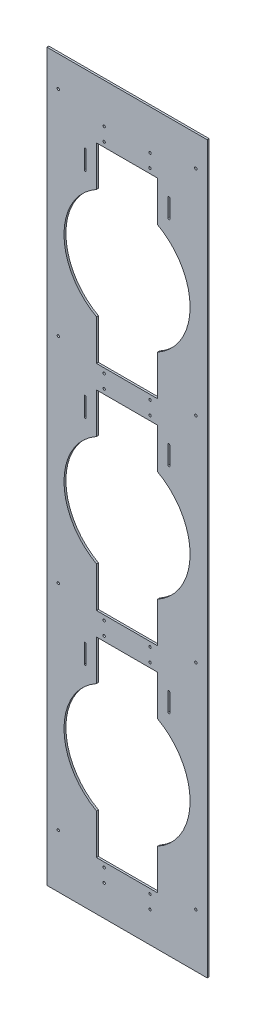
from build123d import *

# Parameters (mm, degrees)
SKETCH1_W                       = 533.4
SKETCH1_H                       = 2413
BOSS_EXTRUDE1_DEPTH             = 6.35
F_5_16_0_3125_DIAMETER_HOLE1_D  = 7.9375
F_1_4_0_25_DIAMETER_SLOT1_DEPTH = 6.35


# Read off the part's stored shape, not the designer's step: 1/4 (0.25) Diameter Slot1
with BuildPart() as part:
    # Sketch1 → Boss-Extrude1 (new body)
    with BuildSketch(Plane.XY):
        with Locations((0, 1206.5)):
            Rectangle(SKETCH1_W, SKETCH1_H)
        with BuildLine():
            Line((-101.6, 797.56), (101.6, 797.56))
            Line((101.6, 797.56), (101.6, 663.332045059))
            ThreePointArc((101.6, 663.332045059), (209.55, 480.06), (101.6, 296.787954941))
            Line((101.6, 296.787954941), (101.6, 162.56))
            Line((101.6, 162.56), (-101.6, 162.56))
            Line((-101.6, 162.56), (-101.6, 296.787954941))
            ThreePointArc((-101.6, 296.787954941), (-209.55, 480.06), (-101.6, 663.332045059))
            Line((-101.6, 663.332045059), (-101.6, 797.56))
        make_face(mode=Mode.SUBTRACT)
        with BuildLine():
            Line((-101.6, 1508.76), (-101.6, 1374.532045059))
            ThreePointArc((-101.6, 1374.532045059), (-209.55, 1191.26), (-101.6, 1007.987954941))
            Line((-101.6, 1007.987954941), (-101.6, 873.76))
            Line((-101.6, 873.76), (101.6, 873.76))
            Line((101.6, 873.76), (101.6, 1007.987954941))
            ThreePointArc((101.6, 1007.987954941), (209.55, 1191.26), (101.6, 1374.532045059))
            Line((101.6, 1374.532045059), (101.6, 1508.76))
            Line((101.6, 1508.76), (-101.6, 1508.76))
        make_face(mode=Mode.SUBTRACT)
        with BuildLine():
            Line((-101.6, 2219.96), (-101.6, 2085.732045059))
            ThreePointArc((-101.6, 2085.732045059), (-209.55, 1902.46), (-101.6, 1719.187954941))
            Line((-101.6, 1719.187954941), (-101.6, 1584.96))
            Line((-101.6, 1584.96), (101.6, 1584.96))
            Line((101.6, 1584.96), (101.6, 1719.187954941))
            ThreePointArc((101.6, 1719.187954941), (209.55, 1902.46), (101.6, 2085.732045059))
            Line((101.6, 2085.732045059), (101.6, 2219.96))
            Line((101.6, 2219.96), (-101.6, 2219.96))
        make_face(mode=Mode.SUBTRACT)
    extrude(amount=BOSS_EXTRUDE1_DEPTH)

    # 5/16 (0.3125) Diameter Hole1 (through all)
    with Locations(Plane.XY.offset(6.35)):
        with Locations((-76.2, 146.685), (-76.2, 102.235), (-228.6, 177.8), (76.2, 102.235), (76.2, 146.685), (-76.2, 857.885), (-76.2, 813.435), (76.2, 813.435), (76.2, 857.885), (-76.2, 1569.085), (-76.2, 1524.635), (76.2, 1524.635), (76.2, 1569.085), (-76.2, 2280.285), (-76.2, 2235.835), (76.2, 2235.835), (76.2, 2280.285), (228.6, 177.8), (-228.6, 889), (228.6, 889), (-228.6, 1600.2), (228.6, 1600.2), (-228.6, 2311.4), (228.6, 2311.4)):
            Hole(F_5_16_0_3125_DIAMETER_HOLE1_D / 2)

    # 1/4 (0.25) Diameter Slot1 outline → 1/4 (0.25) Diameter Slot1 (cut)
    with BuildSketch(Plane.XY):
        with BuildLine():
            Line((135.8265, 2182.569545059), (135.8265, 2122.244545059))
            ThreePointArc((135.8265, 2122.244545059), (139.0015, 2119.069545059), (142.1765, 2122.244545059))
            Line((142.1765, 2122.244545059), (142.1765, 2182.569545059))
            ThreePointArc((142.1765, 2182.569545059), (139.0015, 2185.744545059), (135.8265, 2182.569545059))
        make_face()
        with BuildLine():
            Line((142.1765, 1411.044545059), (142.1765, 1471.369545059))
            ThreePointArc((142.1765, 1471.369545059), (139.0015, 1474.544545059), (135.8265, 1471.369545059))
            Line((135.8265, 1471.369545059), (135.8265, 1411.044545059))
            ThreePointArc((135.8265, 1411.044545059), (139.0015, 1407.869545059), (142.1765, 1411.044545059))
        make_face()
        with BuildLine():
            Line((142.1765, 699.844545059), (142.1765, 760.169545059))
            ThreePointArc((142.1765, 760.169545059), (139.0015, 763.344545059), (135.8265, 760.169545059))
            Line((135.8265, 760.169545059), (135.8265, 699.844545059))
            ThreePointArc((135.8265, 699.844545059), (139.0015, 696.669545059), (142.1765, 699.844545059))
        make_face()
        with BuildLine():
            Line((-142.1765, 2182.569545059), (-142.1765, 2122.244545059))
            ThreePointArc((-142.1765, 2122.244545059), (-139.0015, 2119.069545059), (-135.8265, 2122.244545059))
            Line((-135.8265, 2122.244545059), (-135.8265, 2182.569545059))
            ThreePointArc((-135.8265, 2182.569545059), (-139.0015, 2185.744545059), (-142.1765, 2182.569545059))
        make_face()
        with BuildLine():
            Line((-135.8265, 1411.044545059), (-135.8265, 1471.369545059))
            ThreePointArc((-135.8265, 1471.369545059), (-139.0015, 1474.544545059), (-142.1765, 1471.369545059))
            Line((-142.1765, 1471.369545059), (-142.1765, 1411.044545059))
            ThreePointArc((-142.1765, 1411.044545059), (-139.0015, 1407.869545059), (-135.8265, 1411.044545059))
        make_face()
        with BuildLine():
            Line((-135.8265, 699.844545059), (-135.8265, 760.169545059))
            ThreePointArc((-135.8265, 760.169545059), (-139.0015, 763.344545059), (-142.1765, 760.169545059))
            Line((-142.1765, 760.169545059), (-142.1765, 699.844545059))
            ThreePointArc((-142.1765, 699.844545059), (-139.0015, 696.669545059), (-135.8265, 699.844545059))
        make_face()
    extrude(amount=F_1_4_0_25_DIAMETER_SLOT1_DEPTH, mode=Mode.SUBTRACT)


solid = part.part
